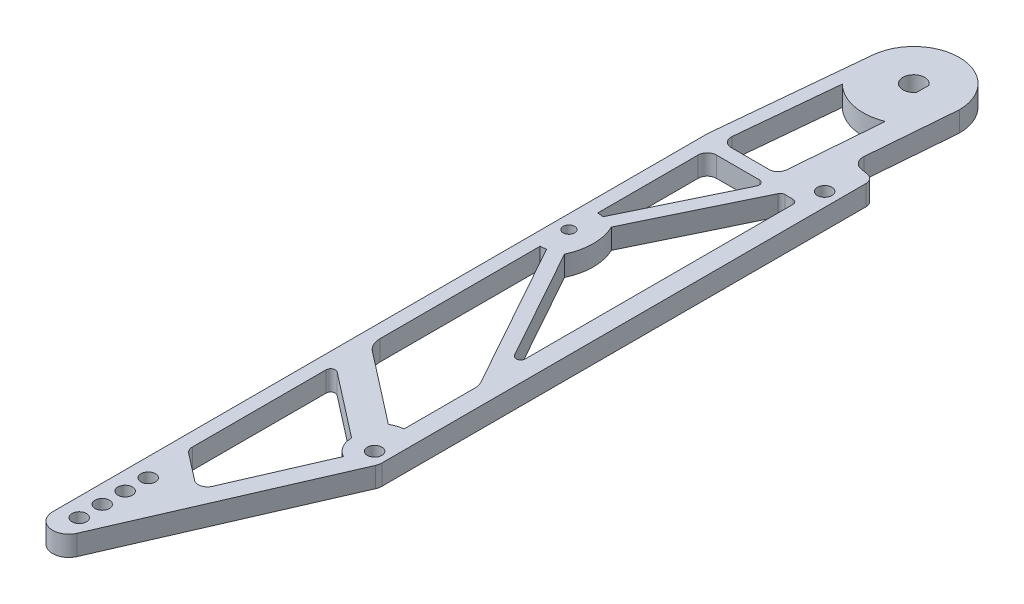
from build123d import *

# Parameters (mm, degrees)
SKETCH2_R           = 2
SKETCH2_R_2         = 1.5875
SKETCH2_R_3         = 1.999999991
BOSS_EXTRUDE1_DEPTH = 5.588


with BuildPart() as part:
    # Sketch2 → Boss-Extrude1 (new body)
    with BuildSketch(Plane(origin=(0, 0, 0), x_dir=(1, 0, 0), z_dir=(0, 1, 0))):
        with BuildLine():
            ThreePointArc((17.295902343, -30.526810701), (16.688093876, -28.878103365), (15.15555913, -28.018449791))
            Line((15.15555913, -28.018449791), (13.238676936, -27.713033224))
            ThreePointArc((13.238676936, -27.713033224), (11.241051513, -26.538356195), (10.573787778, -24.319092227))
            Line((10.573787778, -24.319092227), (12.5603, 0))
            ThreePointArc((12.5603, 0), (0.603657177, 12.545785512), (-12.502275592, 1.2059192))
            Line((-12.502275592, 1.2059192), (-16.498266045, -40.222207921))
            ThreePointArc((-16.498266045, -40.222207921), (-16.507064815, -40.344000039), (-16.51, -40.466074291))
            Line((-16.51, -40.466074291), (-16.51, -221.328861788))
            ThreePointArc((-16.51, -221.328861788), (-12.970187584, -225.680718913), (-7.988667969, -223.101301399))
            Line((-7.988667969, -223.101301399), (16.979901226, -165.677523619))
            ThreePointArc((16.979901226, -165.677523619), (17.216065593, -164.934164738), (17.295902343, -164.158289667))
            Line((17.295902343, -164.158289667), (17.295902343, -30.526810701))
        make_face()
        with Locations((-11.43, -219.075)):
            Circle(SKETCH2_R, mode=Mode.SUBTRACT)
        with Locations((-11.43, -212.725)):
            Circle(SKETCH2_R, mode=Mode.SUBTRACT)
        with Locations((-11.43, -206.375)):
            Circle(SKETCH2_R, mode=Mode.SUBTRACT)
        with Locations((-11.43, -200.025)):
            Circle(SKETCH2_R, mode=Mode.SUBTRACT)
        with BuildLine():
            ThreePointArc((7.135902343, -162.410770806), (8.023611961, -165.648962244), (10.438542905, -167.981776143))
            Line((10.438542905, -167.981776143), (-0.534170778, -193.217289931))
            ThreePointArc((-0.534170778, -193.217289931), (-2.234040931, -194.665234867), (-4.420389569, -194.211381682))
            Line((-4.420389569, -194.211381682), (-11.716886202, -188.551043102))
            ThreePointArc((-11.716886202, -188.551043102), (-12.441018517, -187.661516081), (-12.7, -186.544128716))
            Line((-12.7, -186.544128716), (-12.7, -149.615408258))
            ThreePointArc((-12.7, -149.615408258), (-11.988693683, -148.474898999), (-10.651556899, -148.611951065))
            Line((-10.651556899, -148.611951065), (7.135902343, -162.410770806))
        make_face(mode=Mode.SUBTRACT)
        with BuildLine():
            ThreePointArc((12.215902343, -152.970817152), (10.520298026, -153.359206519), (8.923603828, -154.049487576))
            Line((8.923603828, -154.049487576), (-10.733772403, -138.80005889))
            ThreePointArc((-10.733772403, -138.80005889), (-12.182037035, -137.021004847), (-12.7, -134.786230117))
            Line((-12.7, -134.786230117), (-12.7, -90.4875))
            ThreePointArc((-12.7, -90.4875), (-11.888769677, -90.445936399), (-11.086035141, -90.321680879))
            Line((-11.086035141, -90.321680879), (11.575760855, -131.079432803))
            ThreePointArc((11.575760855, -131.079432803), (12.053263487, -132.272915946), (12.215902343, -133.548047069))
            Line((12.215902343, -133.548047069), (12.215902343, -152.970817152))
        make_face(mode=Mode.SUBTRACT)
        with Locations((13.485902343, -162.410770806)):
            Circle(SKETCH2_R, mode=Mode.SUBTRACT)
        with Locations((-12.7, -82.55)):
            Circle(SKETCH2_R_2, mode=Mode.SUBTRACT)
        with BuildLine():
            Line((-10.16, -44.337182032), (1.663048834, -44.337182032))
            ThreePointArc((1.663048834, -44.337182032), (2.739129831, -44.932682449), (2.806066447, -46.160725831))
            Line((2.806066447, -46.160725831), (-11.055993219, -74.784618621))
            ThreePointArc((-11.055993219, -74.784618621), (-11.873503915, -74.655646925), (-12.7, -74.6125))
            Line((-12.7, -74.6125), (-12.7, -46.877182032))
            ThreePointArc((-12.7, -46.877182032), (-11.956051224, -45.081130808), (-10.16, -44.337182032))
        make_face(mode=Mode.SUBTRACT)
        with BuildLine():
            ThreePointArc((-9.903213406, -40.527182032), (-11.783508673, -39.694838236), (-12.431479451, -37.743315662))
            Line((-12.431479451, -37.743315662), (-9.755434212, -9.99962016))
            ThreePointArc((-9.755434212, -9.99962016), (-2.756273581, -13.695395429), (5.127655889, -12.99492382))
            Line((5.127655889, -12.99492382), (3.069264048, -38.19397392))
            ThreePointArc((3.069264048, -38.19397392), (2.259083254, -39.854914801), (0.537695935, -40.527182032))
            Line((0.537695935, -40.527182032), (-9.903213406, -40.527182032))
        make_face(mode=Mode.SUBTRACT)
        with BuildLine():
            ThreePointArc((2.5, -1.658312395), (-3, 0), (2.5, 1.658312395))
            Line((2.5, 1.658312395), (2.5, -1.658312395))
        make_face(mode=Mode.SUBTRACT)
        with BuildLine():
            ThreePointArc((-7.44734835, -89.025591197), (-5.976040897, -82.55), (-7.44734835, -76.074408803))
            Line((-7.44734835, -76.074408803), (7.575478058, -45.053638233))
            ThreePointArc((7.575478058, -45.053638233), (8.043996088, -44.531101035), (8.718495671, -44.337182032))
            Line((8.718495671, -44.337182032), (10.945902343, -44.337182032))
            ThreePointArc((10.945902343, -44.337182032), (11.843927955, -44.70915642), (12.215902343, -45.607182032))
            Line((12.215902343, -45.607182032), (12.215902343, -119.492817968))
            ThreePointArc((12.215902343, -119.492817968), (11.264685124, -120.722158254), (9.835937715, -120.109971535))
            Line((9.835937715, -120.109971535), (-7.44734835, -89.025591197))
        make_face(mode=Mode.SUBTRACT)
        with Locations((13.485902343, -38.1)):
            Circle(SKETCH2_R_3, mode=Mode.SUBTRACT)
    extrude(amount=BOSS_EXTRUDE1_DEPTH)


solid = part.part
